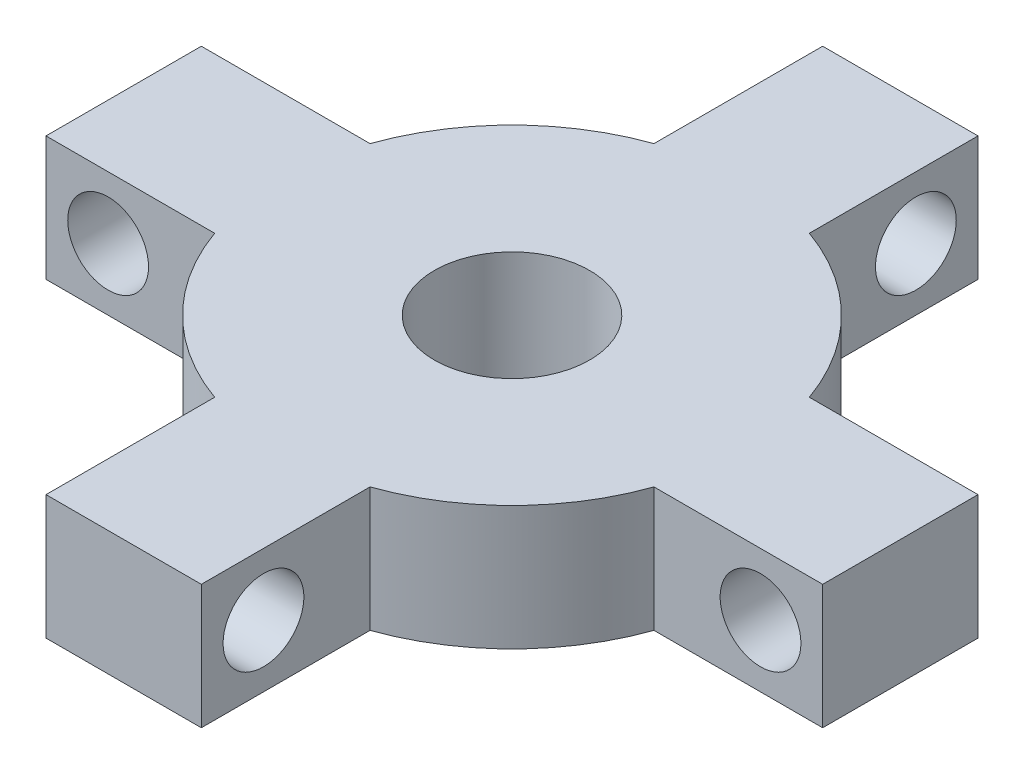
from build123d import *

# Parameters (mm, degrees)
SKETCH1_R               = 19.05
BOSS_EXTRUDE1_DEPTH     = 10.16
SKETCH2_R               = 6.35
CUT_EXTRUDE1_DEPTH      = 15.494
SKETCH6_W               = 12.7
SKETCH6_H               = 12.7
BOSS_EXTRUDE6_DEPTH     = 10.16
BOSS_EXTRUDE7_START     = -10.16
BOSS_EXTRUDE7_DEPTH     = 10.16
CIRPATTERN7_START       = -6.35
CIRPATTERN7_OUTLINE_W   = 10.16
CIRPATTERN7_OUTLINE_H   = 12.7
CIRPATTERN7_DEPTH       = 12.7
CIRPATTERN7_START_2     = -19.05
CIRPATTERN7_2_OUTLINE_W = 10.16
CIRPATTERN7_2_OUTLINE_H = 12.7
CIRPATTERN7_2_DEPTH     = 1.089487758
CIRPATTERN7_START_3     = 17.960512242
CIRPATTERN7_3_OUTLINE_W = 10.16
CIRPATTERN7_3_OUTLINE_H = 12.7
CIRPATTERN7_3_DEPTH     = 1.089487758
SKETCH7_W               = 12.7
SKETCH7_H               = 10.16
BOSS_EXTRUDE9_DEPTH     = 12.7
SKETCH10_W              = 12.7
SKETCH10_H              = 10.16
BOSS_EXTRUDE10_DEPTH    = 12.7
SKETCH11_W              = 12.7
SKETCH11_H              = 10.16
BOSS_EXTRUDE11_DEPTH    = 12.7
SKETCH12_R              = 3.302
CUT_EXTRUDE3_DEPTH      = 16.256
CIRPATTERN8_COUNT       = 4


# Read off the part's stored shape, not the designer's step: CirPattern7
with BuildPart() as part:
    # Sketch1 → Boss-Extrude1 (new body)
    with BuildSketch(Plane(origin=(0, 0, 0), x_dir=(1, 0, 0), z_dir=(0, 1, 0))):
        with Locations(Location((0, 0, 0), (0, 0, 270))):
            Circle(SKETCH1_R)
    extrude(amount=BOSS_EXTRUDE1_DEPTH)

    # Sketch2 → Cut-Extrude1 (cut)
    with BuildSketch(Plane(origin=(0, 10.16, 0), x_dir=(1, 0, 0), z_dir=(0, 1, 0))):
        with Locations(Location((0, 0, 0), (0, 0, 270))):
            Circle(SKETCH2_R)
    extrude(amount=-CUT_EXTRUDE1_DEPTH, mode=Mode.SUBTRACT)



with BuildPart() as body_2:
    # Sketch6 → Boss-Extrude6 (new body)
    with BuildSketch(Plane(origin=(0, 10.16, 0), x_dir=(1, 0, 0), z_dir=(0, 1, 0))):
        with Locations((0, -25.4)):
            Rectangle(SKETCH6_W, SKETCH6_H)
    extrude(amount=-BOSS_EXTRUDE6_DEPTH)


with BuildPart() as part_1:
    add(part.part)

    add(body_2.part)  # Boss-Extrude7 merges body 2
    # Sketch6<4> → Boss-Extrude7 (add)
    with BuildSketch(Plane(origin=(0, 10.16, 0), x_dir=(1, 0, 0), z_dir=(0, 1, 0)).offset(BOSS_EXTRUDE7_START)):
        with BuildLine():
            Line((-6.35, -17.960512242), (-6.35, -19.05))
            Line((-6.35, -19.05), (0, -19.05))
            ThreePointArc((0, -19.05), (-3.221392695, -18.775652561), (-6.35, -17.960512242))
        make_face()
        with BuildLine():
            ThreePointArc((6.35, -17.960512242), (3.221392695, -18.775652561), (0, -19.05))
            Line((0, -19.05), (6.35, -19.05))
            Line((6.35, -19.05), (6.35, -17.960512242))
        make_face()
    extrude(amount=BOSS_EXTRUDE7_DEPTH)

    # CirPattern7 outline → CirPattern7 (add)
    with BuildSketch(Plane.YZ.offset(CIRPATTERN7_START)):
        with Locations((5.08, -12.7)):
            Rectangle(CIRPATTERN7_OUTLINE_W, CIRPATTERN7_OUTLINE_H)
    extrude(amount=CIRPATTERN7_DEPTH)

    # CirPattern7 2 outline → CirPattern7 2 (add)
    with BuildSketch(Plane.YZ.offset(CIRPATTERN7_START_2)):
        with Locations((5.08, 0)):
            Rectangle(CIRPATTERN7_2_OUTLINE_W, CIRPATTERN7_2_OUTLINE_H)
    extrude(amount=CIRPATTERN7_2_DEPTH)

    # CirPattern7 3 outline → CirPattern7 3 (add)
    with BuildSketch(Plane.YZ.offset(CIRPATTERN7_START_3)):
        with Locations((5.08, 0)):
            Rectangle(CIRPATTERN7_3_OUTLINE_W, CIRPATTERN7_3_OUTLINE_H)
    extrude(amount=CIRPATTERN7_3_DEPTH)

    # Sketch7 → Boss-Extrude9 (add)
    with BuildSketch(Plane.ZY.offset(19.05)):
        with Locations((0, 5.08)):
            Rectangle(SKETCH7_W, SKETCH7_H)
    extrude(amount=BOSS_EXTRUDE9_DEPTH)

    # Sketch10 → Boss-Extrude10 (add)
    with BuildSketch(Plane(origin=(19.05, 0, 0), x_dir=(0, 0, -1), z_dir=(1, 0, 0))):
        with Locations((0, 5.08)):
            Rectangle(SKETCH10_W, SKETCH10_H)
    extrude(amount=BOSS_EXTRUDE10_DEPTH)

    # Sketch11 → Boss-Extrude11 (add)
    with BuildSketch(Plane(origin=(0, 0, -19.05), x_dir=(-1, 0, 0), z_dir=(0, 0, -1))):
        with Locations((0, 5.08)):
            Rectangle(SKETCH11_W, SKETCH11_H)
    extrude(amount=BOSS_EXTRUDE11_DEPTH)

    # Sketch12 → Cut-Extrude3 (cut)
    with BuildSketch(Plane.XY.offset(6.35)):
        with Locations((26.67, 5.08)):
            Circle(SKETCH12_R)
    cut_extrude3 = extrude(amount=-CUT_EXTRUDE3_DEPTH, mode=Mode.SUBTRACT)

    # CirPattern8: Cut-Extrude3 ×4 about axis
    cirpattern8_axis = Axis((0, 0, 0), (0, -1, 0))
    for i in range(1, CIRPATTERN8_COUNT):
        add(cut_extrude3.rotate(cirpattern8_axis, i * 360 / CIRPATTERN8_COUNT), mode=Mode.SUBTRACT)


solid = part_1.part
